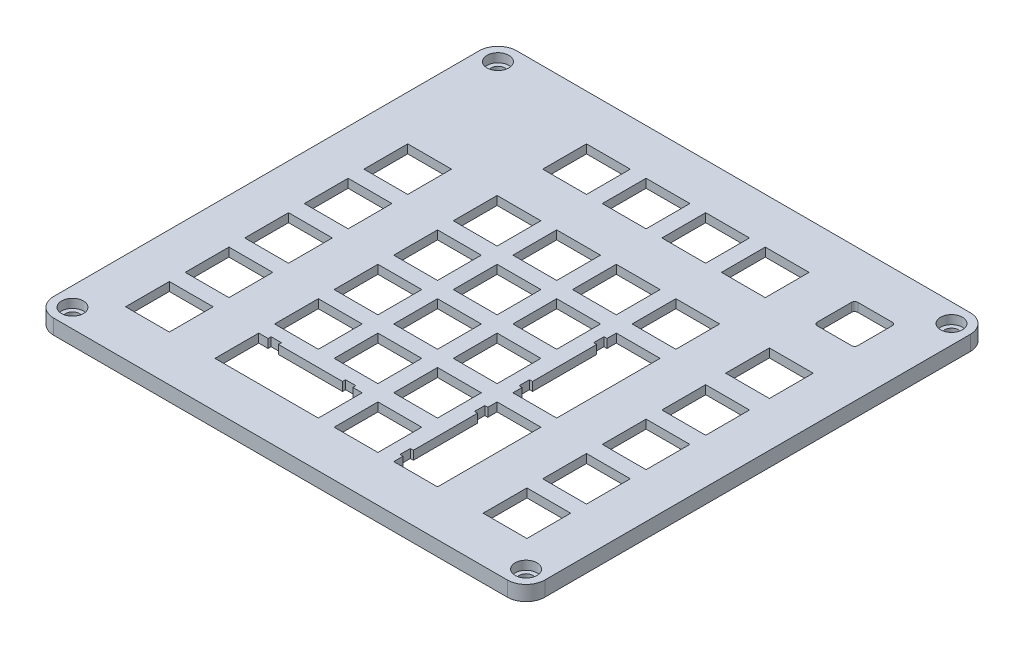
from build123d import *

# Parameters (mm, degrees)
SKETCH1_R           = 2.15
SKETCH1_W           = 13
SKETCH1_H           = 13
SKETCH1_W_2         = 14.000007544
SKETCH1_H_2         = 13.999507543
SKETCH1_W_3         = 13.999607544
SKETCH1_W_4         = 14.000907544
SKETCH1_H_3         = 13.999707543
SKETCH1_H_4         = 13.999607544
SKETCH1_H_5         = 13.999407544
SKETCH1_H_6         = 13.999007544
BOSS_EXTRUDE1_DEPTH = 4.78
SKETCH2_W           = 139
SKETCH2_H           = 130
CUT_EXTRUDE1_DEPTH  = 2
SKETCH4_W           = 20
SKETCH4_H           = 6
CUT_EXTRUDE2_DEPTH  = 2
SKETCH5_W           = 20
SKETCH5_H           = 7
CUT_EXTRUDE3_DEPTH  = 2
SKETCH6_R           = 3.5
CUT_EXTRUDE4_DEPTH  = 2.8
FILLET1_R           = 1


with BuildPart() as part:
    # Sketch1 → Boss-Extrude1 (new body)
    with BuildSketch(Plane(origin=(0, 0, 0), x_dir=(1, 0, 0), z_dir=(0, 1, 0))):
        with BuildLine():
            Line((157.095084651, 142.42407674), (157.095084651, 6.42408329))
            ThreePointArc((157.095084651, 6.42408329), (155.337724391, 2.181440316), (151.095081418, 0.424080056))
            Line((151.095081418, 0.424080056), (6.095053284, 0.424080056))
            ThreePointArc((6.095053284, 0.424080056), (1.852434777, 2.181430182), (0.095084651, 6.424048689))
            Line((0.095084651, 6.424048689), (0.095084651, 142.425076746))
            ThreePointArc((0.095084651, 142.425076746), (1.85215204, 146.667012667), (6.094087961, 148.424080056))
            Line((6.094087961, 148.424080056), (151.095081335, 148.424080056))
            ThreePointArc((151.095081335, 148.424080056), (155.337724367, 146.666719772), (157.095084651, 142.42407674))
        make_face()
        with Locations((6.095084651, 142.424080056)):
            Circle(SKETCH1_R, mode=Mode.SUBTRACT)
        with Locations((151.094123781, 142.424552972)):
            Circle(SKETCH1_R, mode=Mode.SUBTRACT)
        with Locations((151.093705641, 6.423643959)):
            Circle(SKETCH1_R, mode=Mode.SUBTRACT)
        with Locations((6.094666516, 6.425008486)):
            Circle(SKETCH1_R, mode=Mode.SUBTRACT)
        with Locations((135.744073146, 126.813568334)):
            Rectangle(SKETCH1_W, SKETCH1_H, mode=Mode.SUBTRACT)
        Polygon((76.06914099, 15.038508104), (76.06914099, 29.038015647), (73.093839387, 29.038015647), (73.093839387, 30.00811617), (69.795037609, 30.00811617), (69.795037609, 29.038015647), (49.293626562, 29.038015647), (49.293626562, 30.00811617), (45.994824784, 30.00811617), (45.994824784, 29.038015647), (43.019523181, 29.038015647), (43.019523181, 15.038508104), align=None, mode=Mode.SUBTRACT)
        with Locations((135.744073146, 22.038261876)):
            Rectangle(SKETCH1_W_2, SKETCH1_H_2, mode=Mode.SUBTRACT)
        Polygon((100.169053976, 48.088225912), (100.169053976, 45.112924309), (99.199453454, 45.112924309), (99.199453454, 41.812322531), (100.169053976, 41.812322531), (100.169053976, 21.312811484), (99.199453454, 21.312811484), (99.199453454, 18.012309706), (100.169053976, 18.012309706), (100.169053976, 15.038508104), (114.16906152, 15.038508104), (114.16906152, 48.088225912), align=None, mode=Mode.SUBTRACT)
        with Locations((88.119347483, 22.038261876)):
            Rectangle(SKETCH1_W_3, SKETCH1_H_2, mode=Mode.SUBTRACT)
        with Locations((21.443661555, 22.038261876)):
            Rectangle(SKETCH1_W_4, SKETCH1_H_2, mode=Mode.SUBTRACT)
        with Locations((135.744073146, 41.08837214)):
            Rectangle(SKETCH1_W_2, SKETCH1_H_3, mode=Mode.SUBTRACT)
        with Locations((88.119347483, 41.08837214)):
            Rectangle(SKETCH1_W_3, SKETCH1_H_3, mode=Mode.SUBTRACT)
        with Locations((69.069337218, 41.08837214)):
            Rectangle(SKETCH1_W_3, SKETCH1_H_3, mode=Mode.SUBTRACT)
        with Locations((50.019326953, 41.08837214)):
            Rectangle(SKETCH1_W_3, SKETCH1_H_3, mode=Mode.SUBTRACT)
        with Locations((21.443661555, 41.08837214)):
            Rectangle(SKETCH1_W_4, SKETCH1_H_3, mode=Mode.SUBTRACT)
        with Locations((135.744073146, 60.138432406)):
            Rectangle(SKETCH1_W_2, SKETCH1_H_4, mode=Mode.SUBTRACT)
        Polygon((100.169053976, 86.188246443), (100.169053976, 83.21294484), (99.199453454, 83.21294484), (99.199453454, 79.912343061), (100.169053976, 79.912343061), (100.169053976, 59.412732015), (99.199453454, 59.412732015), (99.199453454, 56.112530236), (100.169053976, 56.112530236), (100.169053976, 53.138628634), (114.16906152, 53.138628634), (114.16906152, 86.188246443), align=None, mode=Mode.SUBTRACT)
        with Locations((88.119347483, 60.138432406)):
            Rectangle(SKETCH1_W_3, SKETCH1_H_4, mode=Mode.SUBTRACT)
        with Locations((69.069337218, 60.138432406)):
            Rectangle(SKETCH1_W_3, SKETCH1_H_4, mode=Mode.SUBTRACT)
        with Locations((50.019326953, 60.138432406)):
            Rectangle(SKETCH1_W_3, SKETCH1_H_4, mode=Mode.SUBTRACT)
        with Locations((21.443661555, 60.138432406)):
            Rectangle(SKETCH1_W_4, SKETCH1_H_4, mode=Mode.SUBTRACT)
        with Locations((135.744073146, 79.188442671)):
            Rectangle(SKETCH1_W_2, SKETCH1_H_4, mode=Mode.SUBTRACT)
        with Locations((88.119347483, 79.188442671)):
            Rectangle(SKETCH1_W_3, SKETCH1_H_4, mode=Mode.SUBTRACT)
        with Locations((69.069337218, 79.188442671)):
            Rectangle(SKETCH1_W_3, SKETCH1_H_4, mode=Mode.SUBTRACT)
        with Locations((50.019326953, 79.188442671)):
            Rectangle(SKETCH1_W_3, SKETCH1_H_4, mode=Mode.SUBTRACT)
        with Locations((21.443661555, 79.188442671)):
            Rectangle(SKETCH1_W_4, SKETCH1_H_4, mode=Mode.SUBTRACT)
        with Locations((135.744073146, 99.555083908)):
            Rectangle(SKETCH1_W_2, SKETCH1_H_5, mode=Mode.SUBTRACT)
        with Locations((107.169057748, 98.238352936)):
            Rectangle(SKETCH1_W_2, SKETCH1_H_5, mode=Mode.SUBTRACT)
        with Locations((88.119347483, 98.238352936)):
            Rectangle(SKETCH1_W_3, SKETCH1_H_5, mode=Mode.SUBTRACT)
        with Locations((69.069337218, 98.238352936)):
            Rectangle(SKETCH1_W_3, SKETCH1_H_5, mode=Mode.SUBTRACT)
        with Locations((50.019326953, 98.238352936)):
            Rectangle(SKETCH1_W_3, SKETCH1_H_5, mode=Mode.SUBTRACT)
        with Locations((21.443661555, 98.238352936)):
            Rectangle(SKETCH1_W_4, SKETCH1_H_5, mode=Mode.SUBTRACT)
        with Locations((107.169057748, 126.813568334)):
            Rectangle(SKETCH1_W_2, SKETCH1_H_6, mode=Mode.SUBTRACT)
        with Locations((88.119347483, 126.813568334)):
            Rectangle(SKETCH1_W_3, SKETCH1_H_6, mode=Mode.SUBTRACT)
        with Locations((69.069337218, 126.813568334)):
            Rectangle(SKETCH1_W_3, SKETCH1_H_6, mode=Mode.SUBTRACT)
        with Locations((50.019326953, 126.813568334)):
            Rectangle(SKETCH1_W_3, SKETCH1_H_6, mode=Mode.SUBTRACT)
    extrude(amount=BOSS_EXTRUDE1_DEPTH)

    # Sketch2 → Cut-Extrude1 (cut)
    with BuildSketch(Plane.XZ):
        with Locations((78.595084651, -74.424080056)):
            Rectangle(SKETCH2_W, SKETCH2_H)
    extrude(amount=-CUT_EXTRUDE1_DEPTH, mode=Mode.SUBTRACT)

    # Sketch4 → Cut-Extrude2 (cut)
    with BuildSketch(Plane.XZ):
        with Locations((134.095084651, -142.424080056)):
            Rectangle(SKETCH4_W, SKETCH4_H)
    extrude(amount=-CUT_EXTRUDE2_DEPTH, mode=Mode.SUBTRACT)

    # Sketch5 → Cut-Extrude3 (cut)
    with BuildSketch(Plane.XZ):
        with Locations((25.095084651, -142.924080056)):
            Rectangle(SKETCH5_W, SKETCH5_H)
    extrude(amount=-CUT_EXTRUDE3_DEPTH, mode=Mode.SUBTRACT)

    # Sketch6 → Cut-Extrude4 (cut)
    with BuildSketch(Plane(origin=(0, 4.78, 0), x_dir=(1, 0, 0), z_dir=(0, 1, 0))):
        with Locations((6.095084651, 142.424080056)):
            Circle(SKETCH6_R)
        with Locations((151.094123781, 142.424552972)):
            Circle(SKETCH6_R)
        with Locations((151.093705641, 6.423643959)):
            Circle(SKETCH6_R)
        with Locations((6.094666516, 6.425008486)):
            Circle(SKETCH6_R)
    extrude(amount=-CUT_EXTRUDE4_DEPTH, mode=Mode.SUBTRACT)

    # Fillet1
    fillet1_edges = [part.edges().sort_by_distance(p)[0] for p in [
        (142.244073146, 3.39, -120.313568334),
        (129.244073146, 3.39, -120.313568334),
        (142.244073146, 3.39, -133.313568334),
        (129.244073146, 3.39, -133.313568334),
    ]]
    fillet(fillet1_edges, radius=FILLET1_R)


solid = part.part
